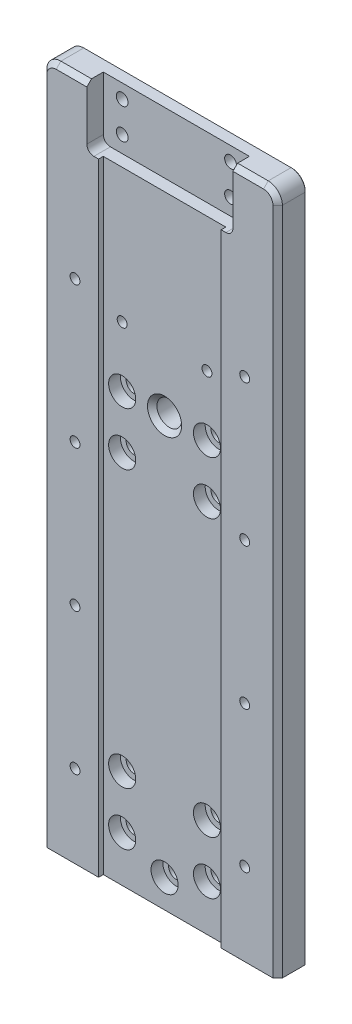
from build123d import *

# Parameters (mm, degrees)
SKETCH1_W               = 100
SKETCH1_H               = 290
BOSS_EXTRUDE1_DEPTH     = 6
SKETCH2_W               = 62
SKETCH2_H               = 26
CUT_EXTRUDE1_DEPTH      = 7
SKETCH3_W               = 52
SKETCH3_H               = 290
CUT_EXTRUDE2_DEPTH      = 2
SKETCH4_R               = 2.5
SKETCH4_R_2             = 5.25
SKETCH4_R_3             = 2.1
SKETCH4_R_4             = 3.3
CUT_EXTRUDE_HOLES_DEPTH = 21
FILLET1_R               = 3
FILLET2_R               = 6
CHAMFER1_SIZE           = 2
SKETCH5_R               = 5.75
CUT_EXTRUDE5_DEPTH      = 5
CHAMFER2_SIZE           = 2
CHAMFER3_SIZE           = 0.3


with BuildPart() as part:
    # Sketch1 → Boss-Extrude1 (new, symmetric)
    with BuildSketch(Plane.XY):
        Rectangle(SKETCH1_W, SKETCH1_H)
    extrude(amount=BOSS_EXTRUDE1_DEPTH, both=True)

    # Sketch2 → Cut-Extrude1 (cut)
    with BuildSketch(Plane.XY.offset(6)):
        with Locations((0, 132)):
            Rectangle(SKETCH2_W, SKETCH2_H)
    extrude(amount=-CUT_EXTRUDE1_DEPTH, mode=Mode.SUBTRACT)

    # Sketch3 → Cut-Extrude2 (cut)
    with BuildSketch(Plane.XY.offset(6)):
        Rectangle(SKETCH3_W, SKETCH3_H)
    extrude(amount=-CUT_EXTRUDE2_DEPTH, mode=Mode.SUBTRACT)

    # Sketch4 → Cut-Extrude HOLES (cut)
    with BuildSketch(Plane.XY.offset(-6)):
        with Locations((-23, 139)):
            Circle(SKETCH4_R)
        with Locations((23, 139)):
            Circle(SKETCH4_R)
        with Locations((23, 126)):
            Circle(SKETCH4_R)
        with Locations((-23, 126)):
            Circle(SKETCH4_R)
        with Locations((0, 36.64)):
            Circle(SKETCH4_R_2)
        with Locations((-18, 62.14)):
            Circle(SKETCH4_R_3)
        with Locations((-18, 36.64)):
            Circle(SKETCH4_R_4)
        with Locations((-18, 14.14)):
            Circle(SKETCH4_R_4)
        with Locations((-36, 70)):
            Circle(SKETCH4_R_3)
        with Locations((-36, 10)):
            Circle(SKETCH4_R_3)
        with Locations((-36, -110)):
            Circle(SKETCH4_R_3)
        with Locations((-36, -50)):
            Circle(SKETCH4_R_3)
        with Locations((-18, -103)):
            Circle(SKETCH4_R_4)
        with Locations((-18, -125.5)):
            Circle(SKETCH4_R_4)
        with Locations((18, -103)):
            Circle(SKETCH4_R_4)
        with Locations((18, -125.5)):
            Circle(SKETCH4_R_4)
        with Locations((0, -133)):
            Circle(SKETCH4_R_4)
        with Locations((36, 70)):
            Circle(SKETCH4_R_3)
        with Locations((18, 62.14)):
            Circle(SKETCH4_R_3)
        with Locations((18, 14.14)):
            Circle(SKETCH4_R_4)
        with Locations((18, 36.64)):
            Circle(SKETCH4_R_4)
        with Locations((36, 10)):
            Circle(SKETCH4_R_3)
        with Locations((36, -50)):
            Circle(SKETCH4_R_3)
        with Locations((36, -110)):
            Circle(SKETCH4_R_3)
    extrude(amount=CUT_EXTRUDE_HOLES_DEPTH, mode=Mode.SUBTRACT)

    # Fillet1
    fillet1_edges = [part.edges().sort_by_distance(p)[0] for p in [
        (31, 119, 2.5),
        (-31, 119, 2.5),
    ]]
    fillet(fillet1_edges, radius=FILLET1_R)

    # Fillet2
    fillet2_edges = [part.edges().sort_by_distance(p)[0] for p in [
        (50, 145, 0),
        (-50, 145, 0),
    ]]
    fillet(fillet2_edges, radius=FILLET2_R)

    # Chamfer1
    chamfer1_edges = [part.edges().sort_by_distance(p)[0] for p in [
        (50, -3, 6),
        (48.242640687, 143.242640687, 6),
        (37.5, 145, 6),
        (-50, -3, 6),
        (-48.242640687, 143.242640687, 6),
        (-37.5, 145, 6),
    ]]
    chamfer(chamfer1_edges, length=CHAMFER1_SIZE)

    # Sketch5 → Cut-Extrude5 (cut)
    with BuildSketch(Plane.XY.offset(4)):
        with Locations((-18, 36.64)):
            Circle(SKETCH5_R)
        with Locations((-18, 14.14)):
            Circle(SKETCH5_R)
        with Locations((18, 14.14)):
            Circle(SKETCH5_R)
        with Locations((18, 36.64)):
            Circle(SKETCH5_R)
        with Locations((18, -103)):
            Circle(SKETCH5_R)
        with Locations((-18, -103)):
            Circle(SKETCH5_R)
        with Locations((-18, -125.5)):
            Circle(SKETCH5_R)
        with Locations((0, -133)):
            Circle(SKETCH5_R)
        with Locations((18, -125.5)):
            Circle(SKETCH5_R)
    extrude(amount=-CUT_EXTRUDE5_DEPTH, mode=Mode.SUBTRACT)

    # Chamfer2
    chamfer2_edges = [part.edges().sort_by_distance(p)[0] for p in [
        (-5.25, 36.64, 4),
    ]]
    chamfer(chamfer2_edges, length=CHAMFER2_SIZE)

    # Chamfer3
    chamfer3_edges = [part.edges().sort_by_distance(p)[0] for p in [
        (-50, -3, -6),
        (-48.242640687, 143.242640687, -6),
        (48.242640687, 143.242640687, -6),
        (50, -3, -6),
        (0, 145, -6),
    ]]
    chamfer(chamfer3_edges, length=CHAMFER3_SIZE)


solid = part.part
